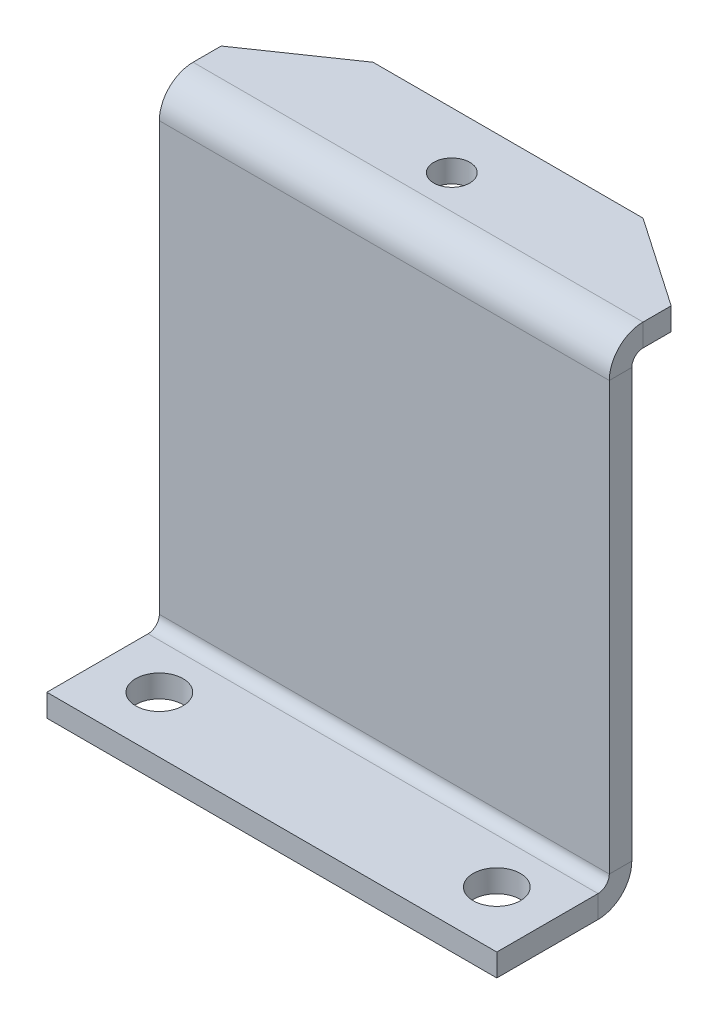
from build123d import *

# Parameters (mm, degrees)
SKETCH_2_W            = 40
SKETCH_2_H            = 10
SKETCH_2_R            = 2.1
EXTRUDE_1_DEPTH       = 2
SKETCH_3_W            = 40
SKETCH_3_H            = 44
EXTRUDE_2_DEPTH       = 2
SKETCH_4_W            = 40
SKETCH_4_H            = 11
SKETCH_4_R            = 1.6
EXTRUDE_3_DEPTH       = 2
CUT_EXTRUDE_1_DEPTH   = 51.911688245
SHEET_START           = -20
SHEET_METAL_1_DEPTH   = 40
SHEET_METAL_1_2_DEPTH = 40


# Read off the part's stored shape, not the designer's step: 转换实体1
with BuildPart() as part:
    # Sketch 2 → 凸台-拉伸1 (new body)
    with BuildSketch(Plane(origin=(0, 0, 0), x_dir=(1, 0, 0), z_dir=(0, 1, 0))):
        Rectangle(SKETCH_2_W, SKETCH_2_H)
        with Locations(Location((-15, 0, 0), (0, 0, 270))):
            Circle(SKETCH_2_R, mode=Mode.SUBTRACT)
        with Locations(Location((15, 0, 0), (0, 0, 90))):
            Circle(SKETCH_2_R, mode=Mode.SUBTRACT)
    extrude(amount=EXTRUDE_1_DEPTH)

    # 草图3 → 凸台-拉伸2 (add)
    with BuildSketch(Plane(origin=(0, 0, -5), x_dir=(-1, 0, 0), z_dir=(0, 0, -1))):
        with Locations((0, 22)):
            Rectangle(SKETCH_3_W, SKETCH_3_H)
    extrude(amount=EXTRUDE_2_DEPTH)

    # 草图4 → 凸台-拉伸3 (add)
    with BuildSketch(Plane(origin=(0, 44, 0), x_dir=(1, 0, 0), z_dir=(0, 1, 0))):
        with Locations((0, 10.5)):
            Rectangle(SKETCH_4_W, SKETCH_4_H)
        with Locations(Location((0, 11, 0), (0, 0, 270))):
            Circle(SKETCH_4_R, mode=Mode.SUBTRACT)
    extrude(amount=-EXTRUDE_3_DEPTH)

    # 草图5 → 切除-拉伸1 (cut, through all)
    with BuildSketch(Plane(origin=(0, 44, 0), x_dir=(1, 0, 0), z_dir=(0, 1, 0))):
        Polygon((-20, 16), (-20, 10.5), (-12, 16), align=None)
        Polygon((20, 10.5), (12, 16), (20, 16), align=None)
    extrude(amount=-CUT_EXTRUDE_1_DEPTH, mode=Mode.SUBTRACT)

    # Sheet Metal 1 outline → Sheet Metal 1 (cut)
    with BuildSketch(Plane.YZ.offset(SHEET_START)):
        with BuildLine():
            Line((44, -5), (41, -5))
            ThreePointArc((41, -5), (43.121320344, -5.878679656), (44, -8))
            Line((44, -8), (44, -5))
        make_face()
        with BuildLine():
            ThreePointArc((3, -7), (0.878679656, -6.121320344), (0, -4))
            Line((0, -4), (0, -7))
            Line((0, -7), (3, -7))
        make_face()
    extrude(amount=SHEET_METAL_1_DEPTH, mode=Mode.SUBTRACT)

    # Sheet Metal 1 2 outline → Sheet Metal 1 2 (add)
    with BuildSketch(Plane.YZ.offset(SHEET_START)):
        with BuildLine():
            ThreePointArc((3, -5), (2.292893219, -4.707106781), (2, -4))
            Line((2, -4), (2, -5))
            Line((2, -5), (3, -5))
        make_face()
        with BuildLine():
            Line((42, -7), (41, -7))
            ThreePointArc((41, -7), (41.707106781, -7.292893219), (42, -8))
            Line((42, -8), (42, -7))
        make_face()
    extrude(amount=SHEET_METAL_1_2_DEPTH)


solid = part.part
